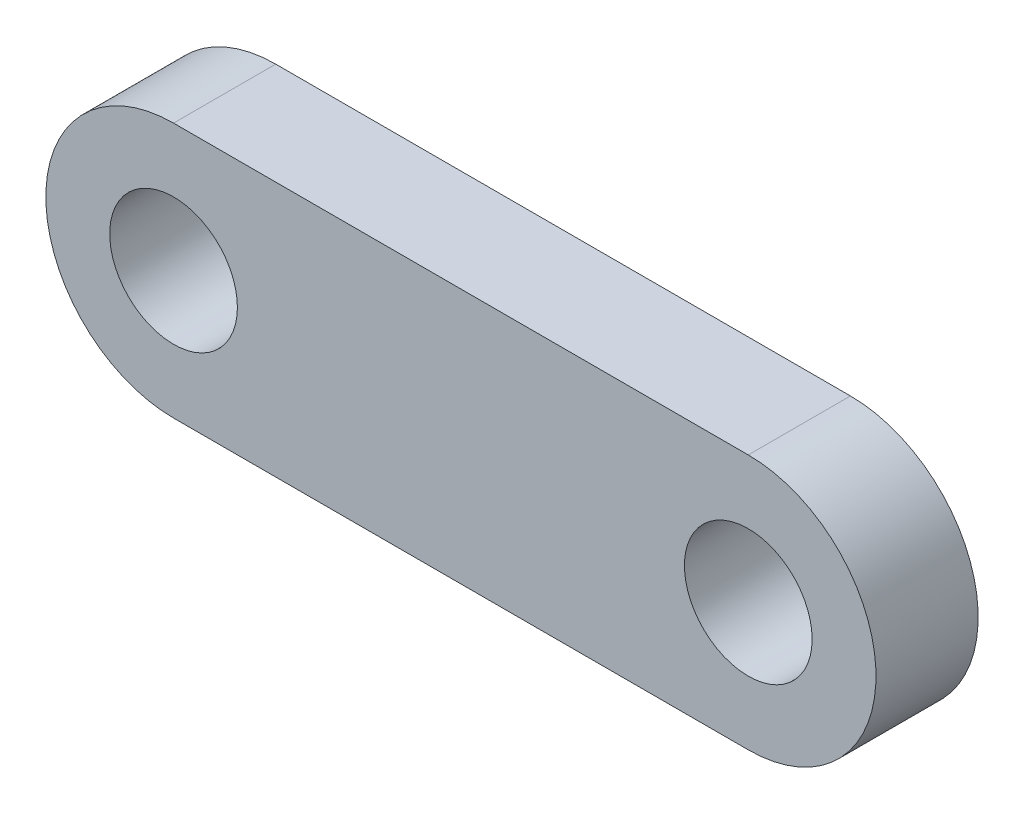
from build123d import *

# Parameters (mm, degrees)
SKETCH1_R           = 1.5875
BOSS_EXTRUDE1_DEPTH = 2.54


with BuildPart() as part:
    # Sketch1 → Boss-Extrude1 (new body)
    with BuildSketch(Plane.XY):
        with BuildLine():
            Line((14.2875, 3.175), (0, 3.175))
            ThreePointArc((0, 3.175), (-3.175, 0), (0, -3.175))
            Line((0, -3.175), (14.2875, -3.175))
            ThreePointArc((14.2875, -3.175), (17.4625, 0), (14.2875, 3.175))
        make_face()
        with Locations((14.2875, 0)):
            Circle(SKETCH1_R, mode=Mode.SUBTRACT)
        Circle(SKETCH1_R, mode=Mode.SUBTRACT)
    extrude(amount=BOSS_EXTRUDE1_DEPTH)


solid = part.part
